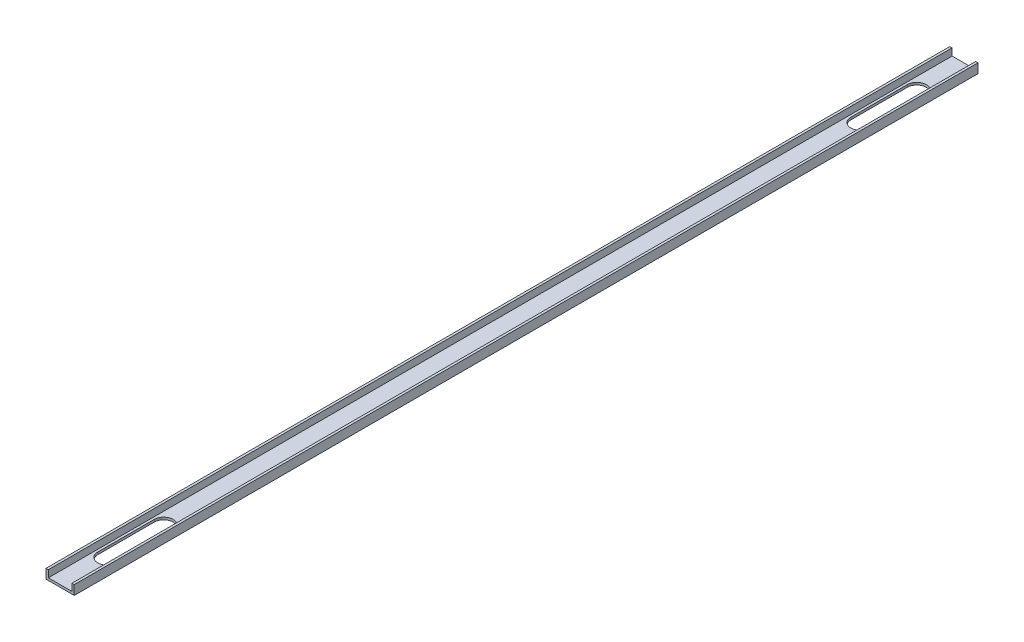
from build123d import *

# Parameters (mm, degrees)
EXTRUDE_F_DEPTH    = 1219.2
CUT_EXTRUDE1_REACH = 1221.832


with BuildPart() as part:
    # Sketch1 → Extrude f (new body)
    with BuildSketch(Plane.XY):
        Polygon((3.175, 3.175), (3.175, 12.7), (0, 12.7), (0, 0), (38.1, 0), (38.1, 12.7), (34.925, 12.7), (34.925, 3.175), align=None)
    extrude(amount=EXTRUDE_F_DEPTH)

    # Sketch2 → Cut-Extrude1 (cut, up to next)
    with BuildSketch(Plane(origin=(0, 3.175, 0), x_dir=(1, 0, 0), z_dir=(0, 1, 0)), mode=Mode.PRIVATE) as cut_extrude1_sk1:
        with BuildLine():
            Line((6.35, -1155.7), (6.35, -1079.5))
            ThreePointArc((6.35, -1079.5), (19.05, -1066.8), (31.75, -1079.5))
            Line((31.75, -1079.5), (31.75, -1155.7))
            ThreePointArc((31.75, -1155.7), (19.05, -1168.4), (6.35, -1155.7))
        make_face()
    cut_extrude1_tool1 = extrude(cut_extrude1_sk1.sketch, amount=-CUT_EXTRUDE1_REACH, mode=Mode.PRIVATE) & part.part
    cut_extrude1 = cut_extrude1_tool1.solids().sort_by_distance((19.05, 3.175, 1117.6))[0]
    add(cut_extrude1, mode=Mode.SUBTRACT)

    # Mirror1: Cut-Extrude1 across plane
    add(cut_extrude1.mirror(Plane.XY.offset(609.6)), mode=Mode.SUBTRACT)


solid = part.part
